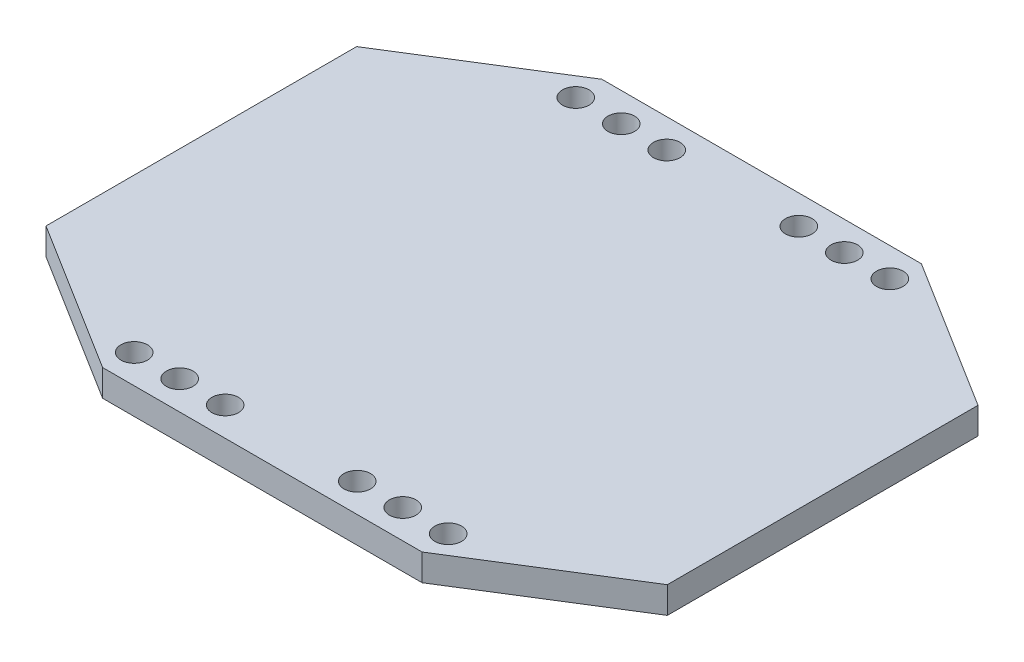
from build123d import *

# Parameters (mm, degrees)
BOSS_EXTRUDE1_DEPTH     = 1.2
SKETCH3_R               = 1.2
CUT_EXTRUDE1_DEPTH      = 37.000138889
MIRROR2_COPY_1_SKETCH_R = 1.2
MIRROR2_COPY_1_DEPTH    = 37.000138889


with BuildPart() as part:
    # Sketch2 → Boss-Extrude1 (new, symmetric)
    with BuildSketch(Plane(origin=(0, 0, 0), x_dir=(1, 0, 0), z_dir=(0, 1, 0))):
        Polygon((-28, -14), (-28, 14), (-14.397156503, 22.5), (14.397156503, 22.5), (28, 14), (28, -14), (14.397156503, -22.5), (-14.397156503, -22.5), align=None)
    extrude(amount=BOSS_EXTRUDE1_DEPTH, both=True)

    # Sketch3 → Cut-Extrude1 (cut, through all)
    with BuildSketch(Plane(origin=(0, 1.2, 0), x_dir=(1, 0, 0), z_dir=(0, 1, 0))):
        with Locations((-14.151637972, 19.9)):
            Circle(SKETCH3_R)
        with Locations((-10.051637972, 19.9)):
            Circle(SKETCH3_R)
        with Locations((-5.951637972, 19.9)):
            Circle(SKETCH3_R)
    cut_extrude1 = extrude(amount=-CUT_EXTRUDE1_DEPTH, mode=Mode.SUBTRACT)

    # Mirror1: Cut-Extrude1 across plane
    add(cut_extrude1.mirror(Plane(origin=(0, 0, 0), x_dir=(0, 0, 1), z_dir=(1, 0, 0))), mode=Mode.SUBTRACT)

    # Mirror2: Cut-Extrude1 across plane
    add(cut_extrude1.mirror(Plane.XY), mode=Mode.SUBTRACT)

    # Mirror2 copy 1 sketch → Mirror2 copy 1 (cut, through all)
    with BuildSketch(Plane(origin=(0, 1.2, 0), x_dir=(-1, 0, 0), z_dir=(0, 1, 0))):
        with Locations((-14.151637972, 19.9)):
            Circle(MIRROR2_COPY_1_SKETCH_R)
        with Locations((-10.051637972, 19.9)):
            Circle(MIRROR2_COPY_1_SKETCH_R)
        with Locations((-5.951637972, 19.9)):
            Circle(MIRROR2_COPY_1_SKETCH_R)
    extrude(amount=-MIRROR2_COPY_1_DEPTH, mode=Mode.SUBTRACT)


solid = part.part
